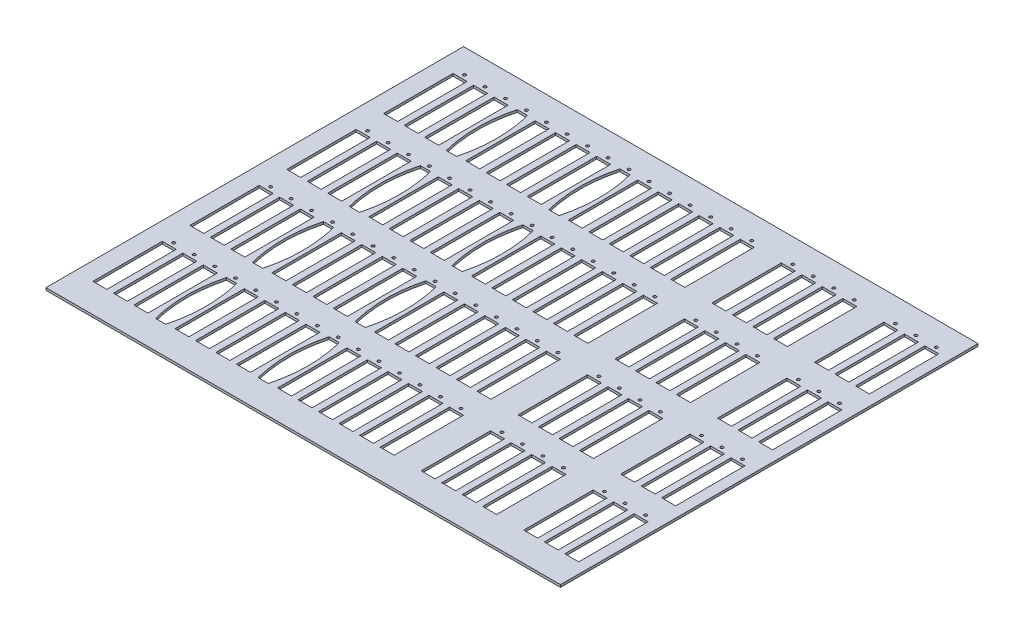
from build123d import *

# Parameters (mm, degrees)
SKETCH1_W           = 674.116
SKETCH1_H           = 547.116
BOSS_EXTRUDE1_DEPTH = 3.175
SKETCH2_R           = 1.905
SKETCH2_W           = 18.288
SKETCH2_H           = 90.932
CUT_EXTRUDE1_DEPTH  = 3.175


with BuildPart() as part:
    # Sketch1 → Boss-Extrude1 (new body)
    with BuildSketch(Plane(origin=(0, 0, 0), x_dir=(1, 0, 0), z_dir=(0, 1, 0))):
        Rectangle(SKETCH1_W, SKETCH1_H)
    extrude(amount=BOSS_EXTRUDE1_DEPTH)

    # Sketch2 → Cut-Extrude1 (cut)
    with BuildSketch(Plane(origin=(0, 3.175, 0), x_dir=(1, 0, 0), z_dir=(0, 1, 0))):
        with Locations((-304.313166667, 242.062)):
            Circle(SKETCH2_R)
        with Locations((-277.4315, 242.062)):
            Circle(SKETCH2_R)
        with Locations((-250.549833333, 242.062)):
            Circle(SKETCH2_R)
        with Locations((-223.668166667, 242.5065)):
            Circle(SKETCH2_R)
        with Locations((-196.7865, 242.062)):
            Circle(SKETCH2_R)
        with Locations((-169.904833333, 242.062)):
            Circle(SKETCH2_R)
        with Locations((-143.023166667, 242.062)):
            Circle(SKETCH2_R)
        with Locations((-116.1415, 242.062)):
            Circle(SKETCH2_R)
        with Locations((-89.259833333, 242.5065)):
            Circle(SKETCH2_R)
        with Locations((-62.378166667, 242.062)):
            Circle(SKETCH2_R)
        with Locations((-35.4965, 242.062)):
            Circle(SKETCH2_R)
        with Locations((-8.614833333, 242.062)):
            Circle(SKETCH2_R)
        with Locations((18.266833333, 242.062)):
            Circle(SKETCH2_R)
        with Locations((45.1485, 242.062)):
            Circle(SKETCH2_R)
        with Locations((72.030166667, 242.062)):
            Circle(SKETCH2_R)
        with Locations((-89.259833333, 115.5065)):
            Circle(SKETCH2_R)
        with Locations((125.7935, 242.062)):
            Circle(SKETCH2_R)
        with Locations((152.675166667, 242.062)):
            Circle(SKETCH2_R)
        with Locations((179.556833333, 242.062)):
            Circle(SKETCH2_R)
        with Locations((206.4385, 242.062)):
            Circle(SKETCH2_R)
        with Locations((-89.259833333, -11.4935)):
            Circle(SKETCH2_R)
        with Locations((260.201833333, 242.062)):
            Circle(SKETCH2_R)
        with Locations((287.0835, 242.062)):
            Circle(SKETCH2_R)
        with Locations((313.965166667, 242.062)):
            Circle(SKETCH2_R)
        with Locations((-277.4315, 115.062)):
            Circle(SKETCH2_R)
        with Locations((-250.549833333, 115.062)):
            Circle(SKETCH2_R)
        with Locations((-89.259833333, -138.4935)):
            Circle(SKETCH2_R)
        with Locations((-196.7865, 115.062)):
            Circle(SKETCH2_R)
        with Locations((-169.904833333, 115.062)):
            Circle(SKETCH2_R)
        with Locations((-143.023166667, 115.062)):
            Circle(SKETCH2_R)
        with Locations((-116.1415, 115.062)):
            Circle(SKETCH2_R)
        with Locations((-223.668166667, 115.5065)):
            Circle(SKETCH2_R)
        with Locations((-62.378166667, 115.062)):
            Circle(SKETCH2_R)
        with Locations((-35.4965, 115.062)):
            Circle(SKETCH2_R)
        with Locations((-8.614833333, 115.062)):
            Circle(SKETCH2_R)
        with Locations((18.266833333, 115.062)):
            Circle(SKETCH2_R)
        with Locations((45.1485, 115.062)):
            Circle(SKETCH2_R)
        with Locations((72.030166667, 115.062)):
            Circle(SKETCH2_R)
        with Locations((-223.668166667, -11.4935)):
            Circle(SKETCH2_R)
        with Locations((125.7935, 115.062)):
            Circle(SKETCH2_R)
        with Locations((152.675166667, 115.062)):
            Circle(SKETCH2_R)
        with Locations((179.556833333, 115.062)):
            Circle(SKETCH2_R)
        with Locations((206.4385, 115.062)):
            Circle(SKETCH2_R)
        with Locations((-223.668166667, -138.4935)):
            Circle(SKETCH2_R)
        with Locations((260.201833333, 115.062)):
            Circle(SKETCH2_R)
        with Locations((287.0835, 115.062)):
            Circle(SKETCH2_R)
        with Locations((313.965166667, 115.062)):
            Circle(SKETCH2_R)
        with Locations((-277.4315, -11.938)):
            Circle(SKETCH2_R)
        with Locations((-250.549833333, -11.938)):
            Circle(SKETCH2_R)
        with Locations((-196.7865, -11.938)):
            Circle(SKETCH2_R)
        with Locations((-169.904833333, -11.938)):
            Circle(SKETCH2_R)
        with Locations((-143.023166667, -11.938)):
            Circle(SKETCH2_R)
        with Locations((-116.1415, -11.938)):
            Circle(SKETCH2_R)
        with Locations((-62.378166667, -11.938)):
            Circle(SKETCH2_R)
        with Locations((-35.4965, -11.938)):
            Circle(SKETCH2_R)
        with Locations((-8.614833333, -11.938)):
            Circle(SKETCH2_R)
        with Locations((18.266833333, -11.938)):
            Circle(SKETCH2_R)
        with Locations((45.1485, -11.938)):
            Circle(SKETCH2_R)
        with Locations((72.030166667, -11.938)):
            Circle(SKETCH2_R)
        with Locations((125.7935, -11.938)):
            Circle(SKETCH2_R)
        with Locations((152.675166667, -11.938)):
            Circle(SKETCH2_R)
        with Locations((179.556833333, -11.938)):
            Circle(SKETCH2_R)
        with Locations((206.4385, -11.938)):
            Circle(SKETCH2_R)
        with Locations((260.201833333, -11.938)):
            Circle(SKETCH2_R)
        with Locations((287.0835, -11.938)):
            Circle(SKETCH2_R)
        with Locations((313.965166667, -11.938)):
            Circle(SKETCH2_R)
        with Locations((-277.4315, -138.938)):
            Circle(SKETCH2_R)
        with Locations((-250.549833333, -138.938)):
            Circle(SKETCH2_R)
        with Locations((-196.7865, -138.938)):
            Circle(SKETCH2_R)
        with Locations((-169.904833333, -138.938)):
            Circle(SKETCH2_R)
        with Locations((-143.023166667, -138.938)):
            Circle(SKETCH2_R)
        with Locations((-116.1415, -138.938)):
            Circle(SKETCH2_R)
        with Locations((-62.378166667, -138.938)):
            Circle(SKETCH2_R)
        with Locations((-35.4965, -138.938)):
            Circle(SKETCH2_R)
        with Locations((-8.614833333, -138.938)):
            Circle(SKETCH2_R)
        with Locations((18.266833333, -138.938)):
            Circle(SKETCH2_R)
        with Locations((45.1485, -138.938)):
            Circle(SKETCH2_R)
        with Locations((72.030166667, -138.938)):
            Circle(SKETCH2_R)
        with Locations((125.7935, -138.938)):
            Circle(SKETCH2_R)
        with Locations((152.675166667, -138.938)):
            Circle(SKETCH2_R)
        with Locations((179.556833333, -138.938)):
            Circle(SKETCH2_R)
        with Locations((206.4385, -138.938)):
            Circle(SKETCH2_R)
        with Locations((260.201833333, -138.938)):
            Circle(SKETCH2_R)
        with Locations((287.0835, -138.938)):
            Circle(SKETCH2_R)
        with Locations((313.965166667, -138.938)):
            Circle(SKETCH2_R)
        with Locations((-304.313166667, 115.062)):
            Circle(SKETCH2_R)
        with Locations((-304.313166667, -11.938)):
            Circle(SKETCH2_R)
        with Locations((-304.313166667, -138.938)):
            Circle(SKETCH2_R)
        with Locations((-277.4315, 190.754)):
            Rectangle(SKETCH2_W, SKETCH2_H)
        with Locations((-304.313166667, 190.754)):
            Rectangle(SKETCH2_W, SKETCH2_H)
        with Locations((-250.549833333, 190.754)):
            Rectangle(SKETCH2_W, SKETCH2_H)
        with BuildLine():
            Line((-230.335666667, 237.1725), (-217.000666667, 237.1725))
            add(Edge.make_bspline(
                [(-217.000666667, 237.1725), (-204.935666667, 190.754), (-217.000666667, 144.3355)],
                knots=[0, 0, 0, 1, 1, 1], degree=2))
            Line((-217.000666667, 144.3355), (-230.335666667, 144.3355))
            add(Edge.make_bspline(
                [(-230.335666667, 237.1725), (-242.400666667, 190.754), (-230.335666667, 144.3355)],
                knots=[0, 0, 0, 1, 1, 1], degree=2))
        make_face()
        with Locations((-196.7865, 190.754)):
            Rectangle(SKETCH2_W, SKETCH2_H)
        with Locations((-169.904833333, 190.754)):
            Rectangle(SKETCH2_W, SKETCH2_H)
        with Locations((-143.023166667, 190.754)):
            Rectangle(SKETCH2_W, SKETCH2_H)
        with Locations((-116.1415, 190.754)):
            Rectangle(SKETCH2_W, SKETCH2_H)
        with Locations((-62.378166667, 190.754)):
            Rectangle(SKETCH2_W, SKETCH2_H)
        with Locations((-35.4965, 190.754)):
            Rectangle(SKETCH2_W, SKETCH2_H)
        with Locations((-8.614833333, 190.754)):
            Rectangle(SKETCH2_W, SKETCH2_H)
        with Locations((18.266833333, 190.754)):
            Rectangle(SKETCH2_W, SKETCH2_H)
        with Locations((45.1485, 190.754)):
            Rectangle(SKETCH2_W, SKETCH2_H)
        with Locations((72.030166667, 190.754)):
            Rectangle(SKETCH2_W, SKETCH2_H)
        with BuildLine():
            Line((-95.927333333, 237.1725), (-82.592333333, 237.1725))
            add(Edge.make_bspline(
                [(-82.592333333, 237.1725), (-70.527333333, 190.754), (-82.592333333, 144.3355)],
                knots=[0, 0, 0, 1, 1, 1], degree=2))
            Line((-82.592333333, 144.3355), (-95.927333333, 144.3355))
            add(Edge.make_bspline(
                [(-95.927333333, 237.1725), (-107.992333333, 190.754), (-95.927333333, 144.3355)],
                knots=[0, 0, 0, 1, 1, 1], degree=2))
        make_face()
        with BuildLine():
            Line((-95.927333333, 110.1725), (-82.592333333, 110.1725))
            add(Edge.make_bspline(
                [(-82.592333333, 110.1725), (-70.527333333, 63.754), (-82.592333333, 17.3355)],
                knots=[0, 0, 0, 1, 1, 1], degree=2))
            Line((-82.592333333, 17.3355), (-95.927333333, 17.3355))
            add(Edge.make_bspline(
                [(-95.927333333, 110.1725), (-107.992333333, 63.754), (-95.927333333, 17.3355)],
                knots=[0, 0, 0, 1, 1, 1], degree=2))
        make_face()
        with Locations((125.7935, 190.754)):
            Rectangle(SKETCH2_W, SKETCH2_H)
        with Locations((152.675166667, 190.754)):
            Rectangle(SKETCH2_W, SKETCH2_H)
        with Locations((179.556833333, 190.754)):
            Rectangle(SKETCH2_W, SKETCH2_H)
        with Locations((206.4385, 190.754)):
            Rectangle(SKETCH2_W, SKETCH2_H)
        with BuildLine():
            Line((-95.927333333, -16.8275), (-82.592333333, -16.8275))
            add(Edge.make_bspline(
                [(-82.592333333, -16.8275), (-70.527333333, -63.246), (-82.592333333, -109.6645)],
                knots=[0, 0, 0, 1, 1, 1], degree=2))
            Line((-82.592333333, -109.6645), (-95.927333333, -109.6645))
            add(Edge.make_bspline(
                [(-95.927333333, -16.8275), (-107.992333333, -63.246), (-95.927333333, -109.6645)],
                knots=[0, 0, 0, 1, 1, 1], degree=2))
        make_face()
        with BuildLine():
            Line((-95.927333333, -143.8275), (-82.592333333, -143.8275))
            add(Edge.make_bspline(
                [(-82.592333333, -143.8275), (-70.527333333, -190.246), (-82.592333333, -236.6645)],
                knots=[0, 0, 0, 1, 1, 1], degree=2))
            Line((-82.592333333, -236.6645), (-95.927333333, -236.6645))
            add(Edge.make_bspline(
                [(-95.927333333, -143.8275), (-107.992333333, -190.246), (-95.927333333, -236.6645)],
                knots=[0, 0, 0, 1, 1, 1], degree=2))
        make_face()
        with Locations((260.201833333, 190.754)):
            Rectangle(SKETCH2_W, SKETCH2_H)
        with Locations((287.0835, 190.754)):
            Rectangle(SKETCH2_W, SKETCH2_H)
        with Locations((313.965166667, 190.754)):
            Rectangle(SKETCH2_W, SKETCH2_H)
        with Locations((-277.4315, 63.754)):
            Rectangle(SKETCH2_W, SKETCH2_H)
        with Locations((-250.549833333, 63.754)):
            Rectangle(SKETCH2_W, SKETCH2_H)
        with BuildLine():
            Line((-230.335666667, 110.1725), (-217.000666667, 110.1725))
            add(Edge.make_bspline(
                [(-217.000666667, 110.1725), (-204.935666667, 63.754), (-217.000666667, 17.3355)],
                knots=[0, 0, 0, 1, 1, 1], degree=2))
            Line((-217.000666667, 17.3355), (-230.335666667, 17.3355))
            add(Edge.make_bspline(
                [(-230.335666667, 110.1725), (-242.400666667, 63.754), (-230.335666667, 17.3355)],
                knots=[0, 0, 0, 1, 1, 1], degree=2))
        make_face()
        with BuildLine():
            Line((-230.335666667, -16.8275), (-217.000666667, -16.8275))
            add(Edge.make_bspline(
                [(-217.000666667, -16.8275), (-204.935666667, -63.246), (-217.000666667, -109.6645)],
                knots=[0, 0, 0, 1, 1, 1], degree=2))
            Line((-217.000666667, -109.6645), (-230.335666667, -109.6645))
            add(Edge.make_bspline(
                [(-230.335666667, -16.8275), (-242.400666667, -63.246), (-230.335666667, -109.6645)],
                knots=[0, 0, 0, 1, 1, 1], degree=2))
        make_face()
        with Locations((-196.7865, 63.754)):
            Rectangle(SKETCH2_W, SKETCH2_H)
        with Locations((-169.904833333, 63.754)):
            Rectangle(SKETCH2_W, SKETCH2_H)
        with Locations((-143.023166667, 63.754)):
            Rectangle(SKETCH2_W, SKETCH2_H)
        with Locations((-116.1415, 63.754)):
            Rectangle(SKETCH2_W, SKETCH2_H)
        with BuildLine():
            Line((-230.335666667, -143.8275), (-217.000666667, -143.8275))
            add(Edge.make_bspline(
                [(-217.000666667, -143.8275), (-204.935666667, -190.246), (-217.000666667, -236.6645)],
                knots=[0, 0, 0, 1, 1, 1], degree=2))
            Line((-217.000666667, -236.6645), (-230.335666667, -236.6645))
            add(Edge.make_bspline(
                [(-230.335666667, -143.8275), (-242.400666667, -190.246), (-230.335666667, -236.6645)],
                knots=[0, 0, 0, 1, 1, 1], degree=2))
        make_face()
        with Locations((-62.378166667, 63.754)):
            Rectangle(SKETCH2_W, SKETCH2_H)
        with Locations((-35.4965, 63.754)):
            Rectangle(SKETCH2_W, SKETCH2_H)
        with Locations((-8.614833333, 63.754)):
            Rectangle(SKETCH2_W, SKETCH2_H)
        with Locations((18.266833333, 63.754)):
            Rectangle(SKETCH2_W, SKETCH2_H)
        with Locations((45.1485, 63.754)):
            Rectangle(SKETCH2_W, SKETCH2_H)
        with Locations((72.030166667, 63.754)):
            Rectangle(SKETCH2_W, SKETCH2_H)
        with Locations((125.7935, 63.754)):
            Rectangle(SKETCH2_W, SKETCH2_H)
        with Locations((152.675166667, 63.754)):
            Rectangle(SKETCH2_W, SKETCH2_H)
        with Locations((179.556833333, 63.754)):
            Rectangle(SKETCH2_W, SKETCH2_H)
        with Locations((206.4385, 63.754)):
            Rectangle(SKETCH2_W, SKETCH2_H)
        with Locations((260.201833333, 63.754)):
            Rectangle(SKETCH2_W, SKETCH2_H)
        with Locations((287.0835, 63.754)):
            Rectangle(SKETCH2_W, SKETCH2_H)
        with Locations((313.965166667, 63.754)):
            Rectangle(SKETCH2_W, SKETCH2_H)
        with Locations((-277.4315, -63.246)):
            Rectangle(SKETCH2_W, SKETCH2_H)
        with Locations((-250.549833333, -63.246)):
            Rectangle(SKETCH2_W, SKETCH2_H)
        with Locations((-196.7865, -63.246)):
            Rectangle(SKETCH2_W, SKETCH2_H)
        with Locations((-169.904833333, -63.246)):
            Rectangle(SKETCH2_W, SKETCH2_H)
        with Locations((-143.023166667, -63.246)):
            Rectangle(SKETCH2_W, SKETCH2_H)
        with Locations((-116.1415, -63.246)):
            Rectangle(SKETCH2_W, SKETCH2_H)
        with Locations((-62.378166667, -63.246)):
            Rectangle(SKETCH2_W, SKETCH2_H)
        with Locations((-35.4965, -63.246)):
            Rectangle(SKETCH2_W, SKETCH2_H)
        with Locations((-8.614833333, -63.246)):
            Rectangle(SKETCH2_W, SKETCH2_H)
        with Locations((18.266833333, -63.246)):
            Rectangle(SKETCH2_W, SKETCH2_H)
        with Locations((45.1485, -63.246)):
            Rectangle(SKETCH2_W, SKETCH2_H)
        with Locations((72.030166667, -63.246)):
            Rectangle(SKETCH2_W, SKETCH2_H)
        with Locations((125.7935, -63.246)):
            Rectangle(SKETCH2_W, SKETCH2_H)
        with Locations((152.675166667, -63.246)):
            Rectangle(SKETCH2_W, SKETCH2_H)
        with Locations((179.556833333, -63.246)):
            Rectangle(SKETCH2_W, SKETCH2_H)
        with Locations((206.4385, -63.246)):
            Rectangle(SKETCH2_W, SKETCH2_H)
        with Locations((260.201833333, -63.246)):
            Rectangle(SKETCH2_W, SKETCH2_H)
        with Locations((287.0835, -63.246)):
            Rectangle(SKETCH2_W, SKETCH2_H)
        with Locations((313.965166667, -63.246)):
            Rectangle(SKETCH2_W, SKETCH2_H)
        with Locations((-277.4315, -190.246)):
            Rectangle(SKETCH2_W, SKETCH2_H)
        with Locations((-250.549833333, -190.246)):
            Rectangle(SKETCH2_W, SKETCH2_H)
        with Locations((-196.7865, -190.246)):
            Rectangle(SKETCH2_W, SKETCH2_H)
        with Locations((-169.904833333, -190.246)):
            Rectangle(SKETCH2_W, SKETCH2_H)
        with Locations((-143.023166667, -190.246)):
            Rectangle(SKETCH2_W, SKETCH2_H)
        with Locations((-116.1415, -190.246)):
            Rectangle(SKETCH2_W, SKETCH2_H)
        with Locations((-62.378166667, -190.246)):
            Rectangle(SKETCH2_W, SKETCH2_H)
        with Locations((-35.4965, -190.246)):
            Rectangle(SKETCH2_W, SKETCH2_H)
        with Locations((-8.614833333, -190.246)):
            Rectangle(SKETCH2_W, SKETCH2_H)
        with Locations((18.266833333, -190.246)):
            Rectangle(SKETCH2_W, SKETCH2_H)
        with Locations((45.1485, -190.246)):
            Rectangle(SKETCH2_W, SKETCH2_H)
        with Locations((72.030166667, -190.246)):
            Rectangle(SKETCH2_W, SKETCH2_H)
        with Locations((125.7935, -190.246)):
            Rectangle(SKETCH2_W, SKETCH2_H)
        with Locations((152.675166667, -190.246)):
            Rectangle(SKETCH2_W, SKETCH2_H)
        with Locations((179.556833333, -190.246)):
            Rectangle(SKETCH2_W, SKETCH2_H)
        with Locations((206.4385, -190.246)):
            Rectangle(SKETCH2_W, SKETCH2_H)
        with Locations((260.201833333, -190.246)):
            Rectangle(SKETCH2_W, SKETCH2_H)
        with Locations((287.0835, -190.246)):
            Rectangle(SKETCH2_W, SKETCH2_H)
        with Locations((313.965166667, -190.246)):
            Rectangle(SKETCH2_W, SKETCH2_H)
        with Locations((-304.313166667, 63.754)):
            Rectangle(SKETCH2_W, SKETCH2_H)
        with Locations((-304.313166667, -63.246)):
            Rectangle(SKETCH2_W, SKETCH2_H)
        with Locations((-304.313166667, -190.246)):
            Rectangle(SKETCH2_W, SKETCH2_H)
    extrude(amount=-CUT_EXTRUDE1_DEPTH, mode=Mode.SUBTRACT)


solid = part.part
